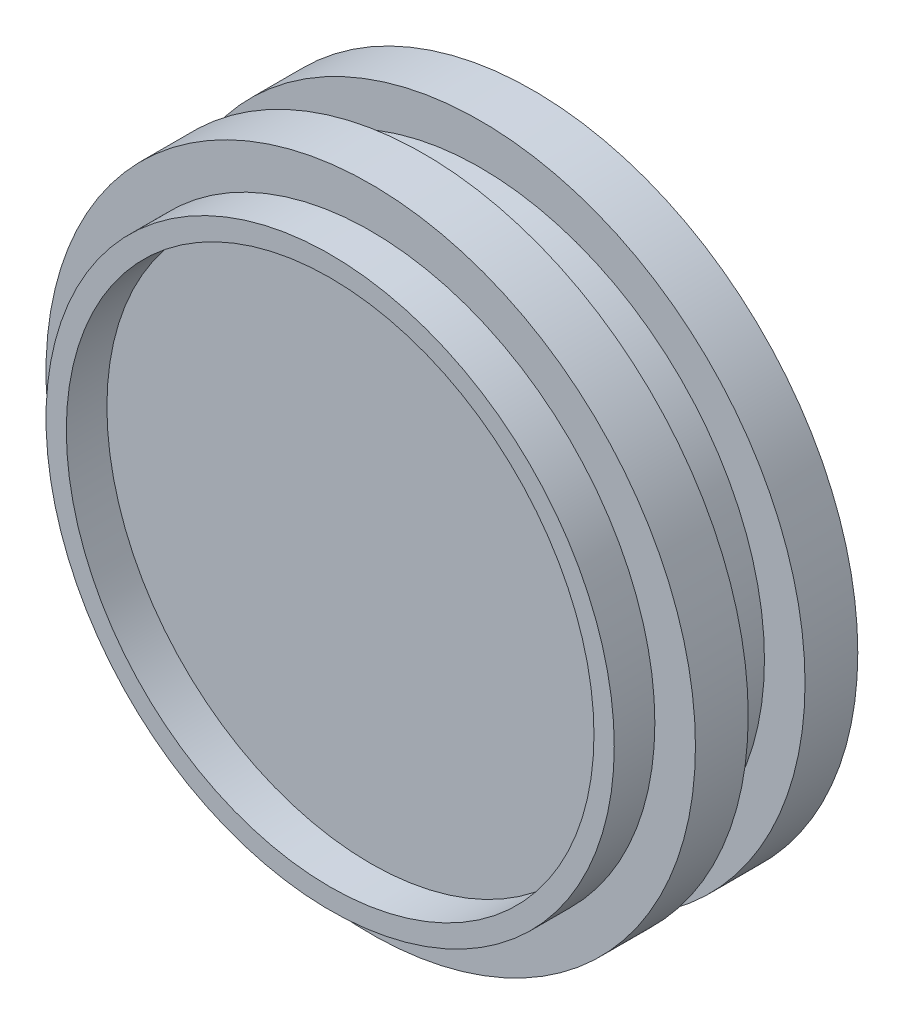
from build123d import *

# Parameters (mm, degrees)
BOSS_EXTRUDE1_DEPTH      = 12.7
BOSS_EXTRUDE1_DEPTH_BACK = 50.8
SKETCH1_R                = 88.9
SKETCH1_R_2              = 82.55
SKETCH1_3_R              = 101.6
SKETCH1_3_R_2            = 88.9
BOSS_EXTRUDE2_DEPTH      = 50.8
SKETCH1_4_R              = 82.55
BOSS_EXTRUDE3_DEPTH      = 25.4
SKETCH4_W                = 12.7
SKETCH4_H                = 17.78


with BuildPart() as part:
    # Sketch1 → Boss-Extrude1 (new, two sides: drawn at the far end of the back side and taken through both)
    with BuildSketch(Plane.XY.offset(-BOSS_EXTRUDE1_DEPTH_BACK)):
        Circle(SKETCH1_R)
        Circle(SKETCH1_R_2, mode=Mode.SUBTRACT)
    extrude(amount=BOSS_EXTRUDE1_DEPTH + BOSS_EXTRUDE1_DEPTH_BACK)


with BuildPart() as body_2:
    # Sketch1<3> → Boss-Extrude2 (new body)
    with BuildSketch(Plane.XY):
        Circle(SKETCH1_3_R)
        Circle(SKETCH1_3_R_2, mode=Mode.SUBTRACT)
    extrude(amount=-BOSS_EXTRUDE2_DEPTH)

    # Sketch4 → Cut-Revolve1 (revolve, cut)
    with BuildSketch(Plane(origin=(0, 0, 0), x_dir=(1, 0, 0), z_dir=(0, 1, 0))):
        with Locations((95.25, 25.4)):
            Rectangle(SKETCH4_W, SKETCH4_H)
    revolve(axis=Axis((0, 0, 0), (0, 0, 1)), mode=Mode.SUBTRACT)


with BuildPart() as body_3:
    # Sketch1<4> → Boss-Extrude3 (new body)
    with BuildSketch(Plane.XY):
        Circle(SKETCH1_4_R)
    extrude(amount=-BOSS_EXTRUDE3_DEPTH)


with BuildPart() as cut_revolve1_piece_1:
    # of the separate pieces the step leaves, piece 1, a body of its own (cut_revolve1_pieces)
    add(body_2.part.solids().sort_by_distance((101.6, 0, 0))[0])


with BuildPart() as cut_revolve1_piece_2:
    # of the separate pieces the step leaves, piece 2, a body of its own (cut_revolve1_pieces)
    add(body_2.part.solids().sort_by_distance((101.6, 0, -34.29))[0])


solid = Compound([part.part, body_3.part, cut_revolve1_piece_1.part, cut_revolve1_piece_2.part])
